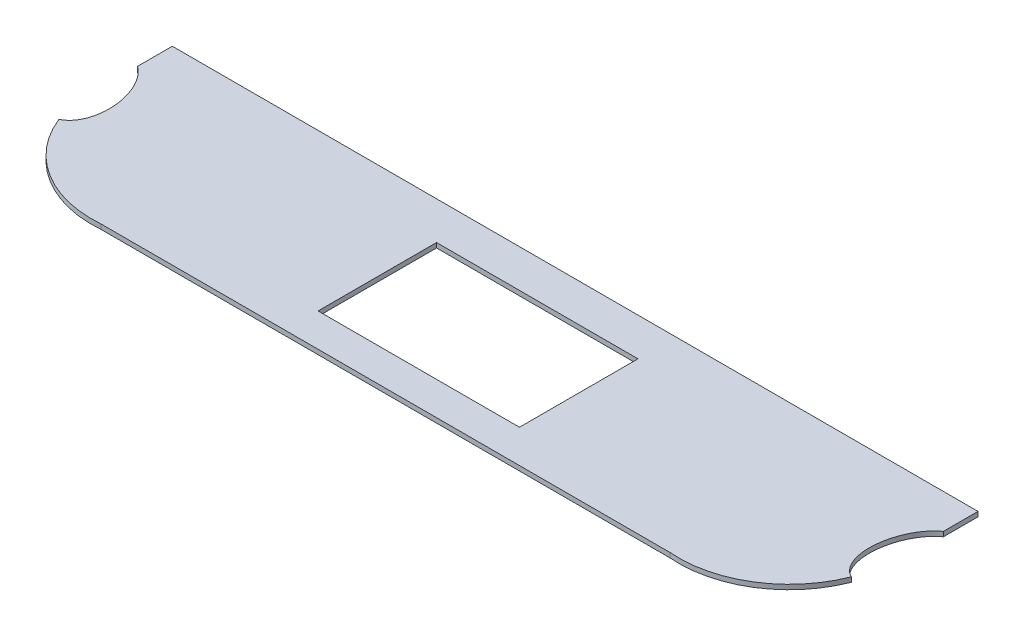
from build123d import *

# Parameters (mm, degrees)
BOSS_EXTRUDE1_DEPTH = 2.54
SKETCH2_W           = 107.95
SKETCH2_H           = 63.5
CUT_EXTRUDE1_DEPTH  = 226.664855764
CUT_EXTRUDE2_START  = -2.54
CUT_EXTRUDE2_DEPTH  = 2.54


# Read off the part's stored shape, not the designer's step: Cut-Extrude2
with BuildPart() as part:
    # Sketch1 → Boss-Extrude1 (new body)
    with BuildSketch(Plane(origin=(0, 0, 0), x_dir=(1, 0, 0), z_dir=(0, 1, 0))):
        with BuildLine():
            Line((215.9, -14.612459999), (215.9, 36.187540001))
            Line((215.9, 36.187540001), (-215.9, 36.187540001))
            Line((-215.9, 36.187540001), (-215.9, -14.612459999))
            ThreePointArc((-215.9, -14.612459999), (-194.259204241, -52.648965299), (-152.4, -65.412459999))
            Line((-152.4, -65.412459999), (152.4, -65.412459999))
            ThreePointArc((152.4, -65.412459999), (194.259204241, -52.648965299), (215.9, -14.612459999))
        make_face()
    extrude(amount=BOSS_EXTRUDE1_DEPTH)

    # Sketch2 → Cut-Extrude1 (cut, through all)
    with BuildSketch(Plane(origin=(0, 2.54, 0), x_dir=(1, 0, 0), z_dir=(0, 1, 0))):
        with Locations((0, -15.875)):
            Rectangle(SKETCH2_W, SKETCH2_H)
    extrude(amount=-CUT_EXTRUDE1_DEPTH, mode=Mode.SUBTRACT)

    # Cut-Extrude2 outline → Cut-Extrude2 (cut)
    with BuildSketch(Plane(origin=(0, 2.54, 0), x_dir=(1, 0, 0), z_dir=(0, 1, 0)).offset(CUT_EXTRUDE2_START)):
        with BuildLine():
            add(Edge.make_bspline(
                [(-215.899999994, 17.535115527), (-215.566109371, 17.300913161), (-214.20332449, 16.275815014), (-211.81883724, 13.954885046), (-208.930212321, 9.901978384), (-206.463783195, 4.892933776), (-204.667192604, -0.774398824), (-203.719076257, -6.643595697), (-203.665482888, -12.226688771), (-204.419435916, -17.146217321), (-205.817811739, -21.205445303), (-207.685847242, -24.362515926), (-209.864985661, -26.655137817), (-211.469591298, -27.686917669), (-212.297814145, -28.088227647), (-212.355105742, -28.115375011)],
                knots=[0.114839475, 0.114839475, 0.114839475, 0.114839475, 0.125, 0.15625, 0.1875, 0.21875, 0.25, 0.28125, 0.3125, 0.34375, 0.375, 0.40625, 0.4375, 0.46875, 0.471073894, 0.471073894, 0.471073894, 0.471073894], degree=3))
            Line((-215.899999994, 17.535115527), (-215.9, -14.612459999))
            ThreePointArc((-215.9, -14.612459999), (-214.527170136, -21.468828255), (-212.355105742, -28.115375011))
        make_face()
        with BuildLine():
            add(Edge.make_bspline(
                [(212.34685517, -28.136325182), (212.279954773, -28.104999749), (211.441572028, -27.702034349), (209.825715206, -26.66689516), (207.64277821, -24.378244073), (205.76942942, -21.224763186), (204.364219868, -17.16852613), (203.602011314, -12.251147017), (203.646262202, -6.669088999), (204.584578872, -0.799601085), (206.371728131, 4.869386838), (208.829838854, 9.881274858), (211.711764265, 13.937884913), (214.130027538, 16.298772476), (215.528958726, 17.345764848), (215.899999994, 17.602596054)],
                knots=[0.028537672, 0.028537672, 0.028537672, 0.028537672, 0.03125, 0.0625, 0.09375, 0.125, 0.15625, 0.1875, 0.21875, 0.25, 0.28125, 0.3125, 0.34375, 0.375, 0.386307936, 0.386307936, 0.386307936, 0.386307936], degree=3))
            ThreePointArc((212.34685517, -28.136325182), (214.524310397, -21.479717116), (215.9, -14.612459999))
            Line((215.9, -14.612459999), (215.899999994, 17.602596054))
        make_face()
    extrude(amount=CUT_EXTRUDE2_DEPTH, mode=Mode.SUBTRACT)


solid = part.part
